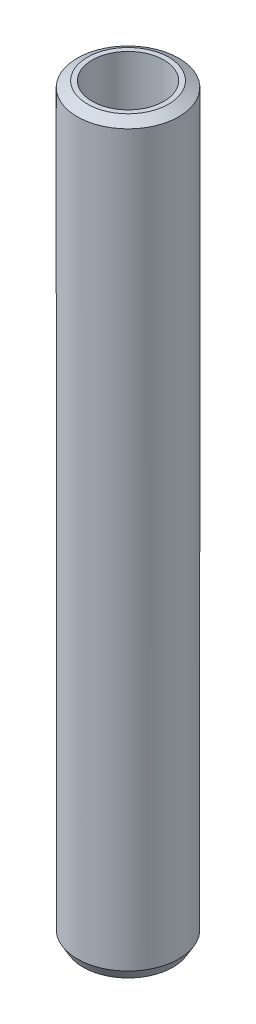
from build123d import *
from OCP.BRepFilletAPI import BRepFilletAPI_MakeChamfer

# Parameters (mm, degrees)
SKETCH1_R           = 20
BOSS_EXTRUDE1_DEPTH = 293.54125386
SKETCH2_R           = 14.116720023
CUT_EXTRUDE1_DEPTH  = 295.900776055
CHAMFER1_SIZE       = 2.308503678
CHAMFER1_SIZE2      = 3.99844566


with BuildPart() as part:
    # Sketch1 → Boss-Extrude1 (new body)
    with BuildSketch(Plane(origin=(0, 0, 0), x_dir=(1, 0, 0), z_dir=(0, 1, 0))):
        Circle(SKETCH1_R)
    extrude(amount=BOSS_EXTRUDE1_DEPTH)

    # Sketch2 → Cut-Extrude1 (cut, through all)
    with BuildSketch(Plane(origin=(0, 0, 0), x_dir=(1, 0, 0), z_dir=(0, 1, 0))):
        Circle(SKETCH2_R)
    extrude(amount=CUT_EXTRUDE1_DEPTH, mode=Mode.SUBTRACT)

    # Chamfer1: one chamfer whose edges measure the first distance from different faces: ONE call of the kernel's chamfer builder (chamfer() names one face for all edges)
    chamfer1_edges_1 = [part.edges().sort_by_distance(p)[0] for p in [
        (-20, 293.54125386, 0),
    ]]
    chamfer1_side_1 = [part.faces().sort_by_distance(p)[0] for p in [
        (-20, 146.77062693, 0),
    ]]
    chamfer1_edges_2 = [part.edges().sort_by_distance(p)[0] for p in [
        (-20, 0, 0),
    ]]
    chamfer1_side_2 = [part.faces().sort_by_distance(p)[0] for p in [
        (-19.434314575, 0, 0),
    ]]
    chamfer1 = BRepFilletAPI_MakeChamfer(part.part.solid().wrapped)
    for e in chamfer1_edges_1:
        chamfer1.Add(CHAMFER1_SIZE, CHAMFER1_SIZE2, e.wrapped, chamfer1_side_1[0].wrapped)  # the first distance lies on this face
    for e in chamfer1_edges_2:
        chamfer1.Add(CHAMFER1_SIZE, CHAMFER1_SIZE2, e.wrapped, chamfer1_side_2[0].wrapped)  # the first distance lies on this face
    add(Compound.cast(chamfer1.Shape()), mode=Mode.REPLACE)


solid = part.part
